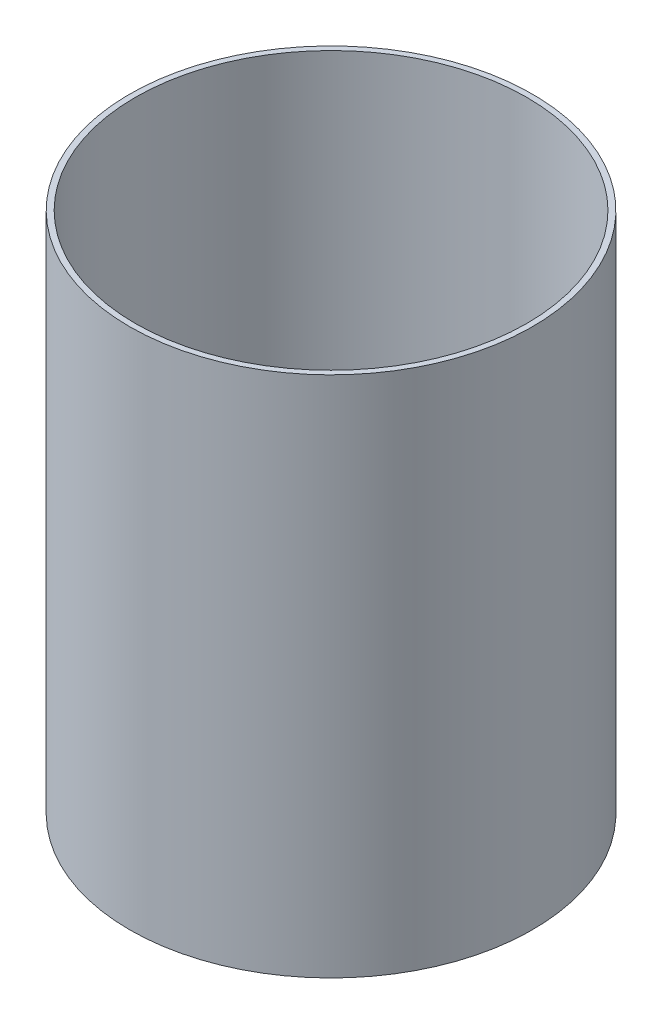
from build123d import *

# Parameters (mm, degrees)
SKETCH1_R           = 78.359
SKETCH1_R_2         = 76.1746
BOSS_EXTRUDE1_DEPTH = 203.2


with BuildPart() as part:
    # Sketch1 → Boss-Extrude1 (new body)
    with BuildSketch(Plane(origin=(0, 0, 0), x_dir=(1, 0, 0), z_dir=(0, 1, 0))):
        Circle(SKETCH1_R)
        Circle(SKETCH1_R_2, mode=Mode.SUBTRACT)
    extrude(amount=BOSS_EXTRUDE1_DEPTH)


solid = part.part
